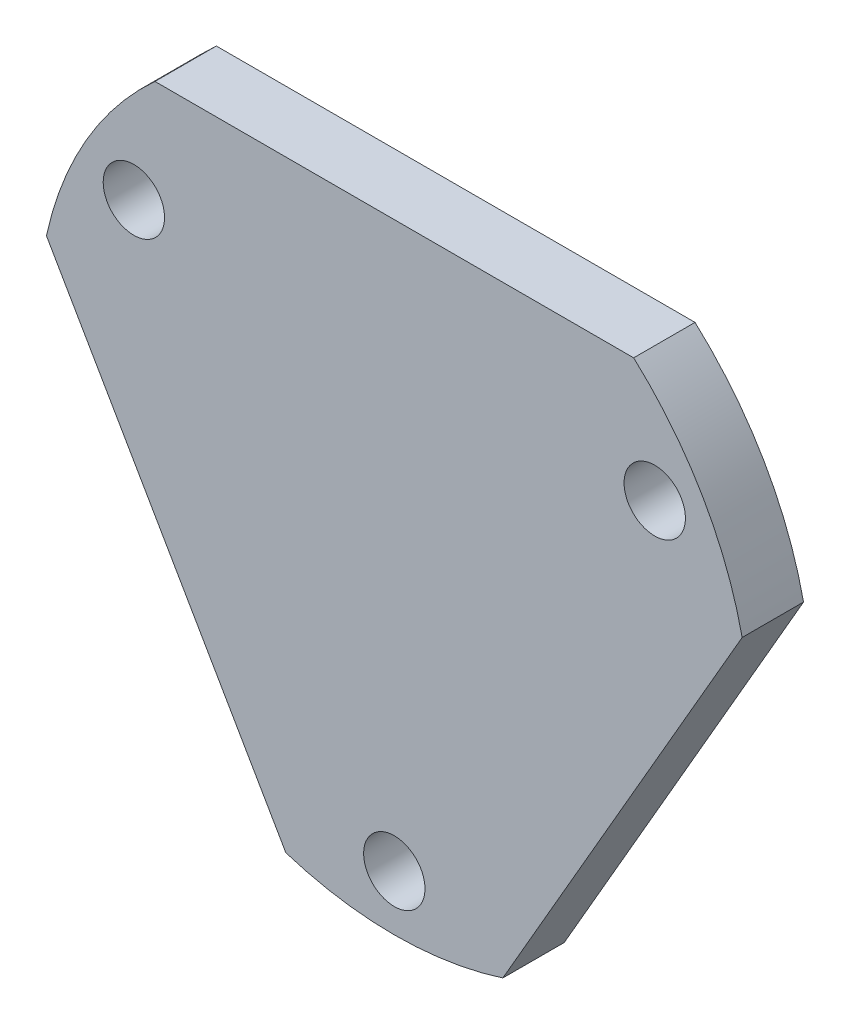
from build123d import *

# Parameters (mm, degrees)
SKETCH_1_R      = 1.25
EXTRUDE_1_DEPTH = 2.5


with BuildPart() as part:
    # Эскиз1 → Бобышка-Вытянуть1 (new body)
    with BuildSketch(Plane(origin=(0, 0, 0), x_dir=(1, 0, 0), z_dir=(0, 0, -1))):
        with BuildLine():
            Line((-9.75, -10.732543967), (9.75, -10.732543967))
            ThreePointArc((9.75, -10.732543967), (12.557368355, -7.25), (14.169655723, -3.077475703))
            Line((14.169655723, -3.077475703), (4.419655723, 13.81001967))
            ThreePointArc((4.419655723, 13.81001967), (0, 14.5), (-4.419655723, 13.81001967))
            Line((-4.419655723, 13.81001967), (-14.169655723, -3.077475703))
            ThreePointArc((-14.169655723, -3.077475703), (-12.557368355, -7.25), (-9.75, -10.732543967))
        make_face()
        with Locations((0, 12.25)):
            Circle(SKETCH_1_R, mode=Mode.SUBTRACT)
        with Locations((10.608811196, -6.125)):
            Circle(SKETCH_1_R, mode=Mode.SUBTRACT)
        with Locations((-10.608811196, -6.125)):
            Circle(SKETCH_1_R, mode=Mode.SUBTRACT)
    extrude(amount=EXTRUDE_1_DEPTH)


solid = part.part
